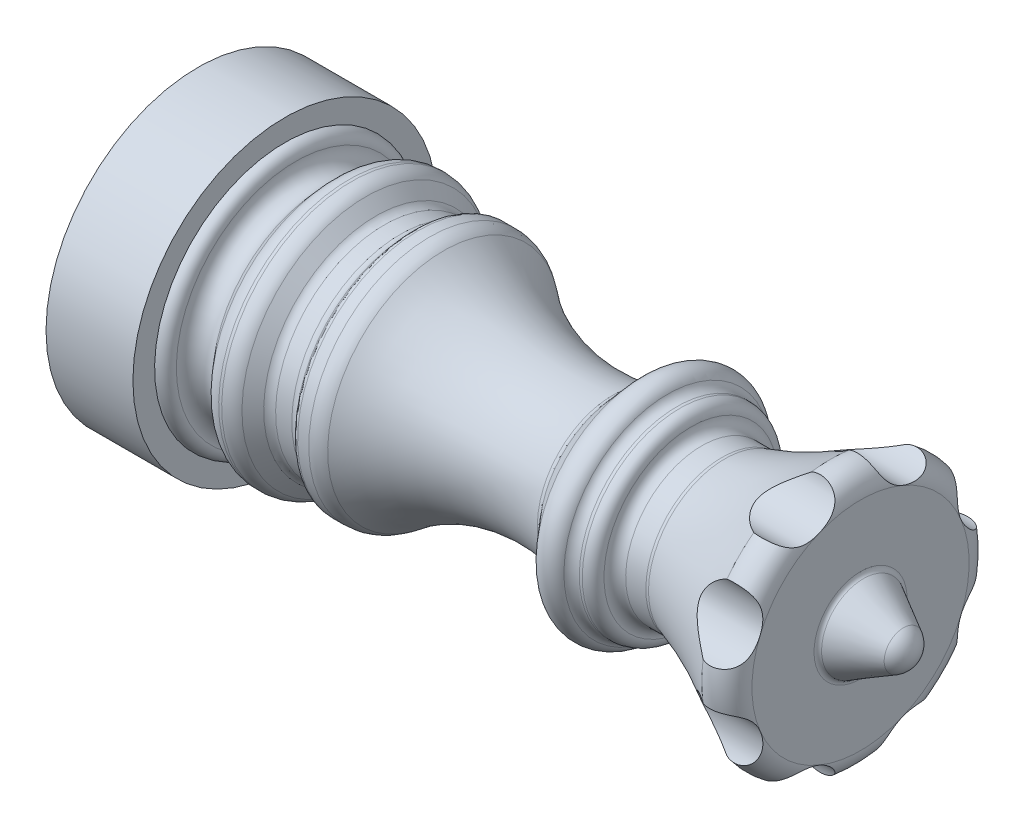
from build123d import *

# Parameters (mm, degrees)
FILETE2_R                 = 0.5
FILETE3_R                 = 0.5
ESBO_O2_R                 = 1.75
CORTE_EXTRUS_O1_DEPTH     = 5
PADR_OCIRCULAR1_COUNT     = 8
FILETE4_R                 = 0.25
FILETE5_R                 = 1
CORPO_MOVER_COPIAR1_ANGLE = 22.5
CHANFRO1_SIZE             = 0.35
SKETCH1_R                 = 7
BOSS_EXTRUDE1_DEPTH       = 1
BOSS_EXTRUDE2_START       = 3
SKETCH1_2_R               = 7
BOSS_EXTRUDE2_DEPTH       = 3
SKETCH2_R                 = 6.05
CUT_EXTRUDE1_DEPTH        = 3.2


with BuildPart() as part:
    # Esboço1 → Revolução1 (revolve)
    with BuildSketch(Plane.XY, mode=Mode.PRIVATE) as revolu_o1_sk:
        with BuildLine():
            Line((0, 6), (0, 0))
            Line((0, 0), (30, 0))
            ThreePointArc((30, 0), (29.859693117, 0.516050041), (29.477403873, 0.890013408))
            Line((29.477403873, 0.890013408), (27.5, 1.99328989))
            Line((27.5, 1.99328989), (27.5, 5))
            ThreePointArc((27.5, 5), (27.049451102, 5.835525874), (26.103793027, 5.918161225))
            ThreePointArc((26.103793027, 5.918161225), (23.749832258, 4.497667656), (21.187881336, 3.5))
            Line((21.187881336, 3.5), (19.687881336, 3.5))
            Line((19.687881336, 3.5), (19.687881336, 4.5))
            Line((19.687881336, 4.5), (18.687881336, 4.5))
            ThreePointArc((18.687881336, 4.5), (18.207548082, 5.106223569), (17.462095944, 4.9))
            Line((17.462095944, 4.9), (16.245094511, 3.5))
            ThreePointArc((16.245094511, 3.5), (11.885183427, 3.516397611), (8.040424988, 5.572346561))
            Line((8.040424988, 5.572346561), (7.040424988, 5.572346561))
            Line((7.040424988, 5.572346561), (6.542891713, 5))
            Line((6.542891713, 5), (5.342891713, 5))
            Line((5.342891713, 5), (4.727740801, 5.707650175))
            ThreePointArc((4.727740801, 5.707650175), (4.438726914, 5.92346708), (4.086237658, 6))
            Line((4.086237658, 6), (3.949519781, 6))
            ThreePointArc((3.949519781, 6), (3.597030525, 5.92346708), (3.308016638, 5.707650175))
            Line((3.308016638, 5.707650175), (2.728296706, 5.04075868))
            ThreePointArc((2.728296706, 5.04075868), (1.954854833, 4.844329468), (1.5, 5.5))
            ThreePointArc((1.5, 5.5), (1.353553391, 5.853553391), (1, 6))
            Line((1, 6), (0, 6))
        make_face()
    revolve(revolu_o1_sk.sketch.rotate(Axis((0, 0, 0), (1, 0, 0)), 90), axis=Axis((0, 0, 0), (1, 0, 0)))

    # Filete2
    filete2_edges = [part.edges().sort_by_distance(p)[0] for p in [
        (19.687881336, 0, -4.5),
    ]]
    fillet(filete2_edges, radius=FILETE2_R)

    # Filete3
    filete3_edges = [part.edges().sort_by_distance(p)[0] for p in [
        (5.342891713, 0, -5),
        (6.542891713, 0, -5),
        (16.245094511, 0, -3.5),
        (18.687881336, 0, -4.5),
        (19.687881336, 0, -3.5),
        (21.187881336, 0, -3.5),
    ]]
    fillet(filete3_edges, radius=FILETE3_R - 0.0001)  # a hair under: the kernel refuses the full size

    # Esboço2 → Corte-extrusão1 (cut)
    with BuildSketch(Plane(origin=(27.5, 0, 0), x_dir=(0, 0, -1), z_dir=(1, 0, 0))):
        with Locations((-6.75, 0)):
            Circle(ESBO_O2_R)
    corte_extrus_o1 = extrude(amount=-CORTE_EXTRUS_O1_DEPTH, mode=Mode.SUBTRACT)

    # PadrãoCircular1: Corte-extrusão1 ×8 about axis
    padr_ocircular1_axis = Axis((0, 0, 0), (1, 0, 0))
    for i in range(1, PADR_OCIRCULAR1_COUNT):
        add(corte_extrus_o1.rotate(padr_ocircular1_axis, i * 360 / PADR_OCIRCULAR1_COUNT), mode=Mode.SUBTRACT)

    # Filete4
    filete4_edges = [part.edges().sort_by_distance(p)[0] for p in [
        (27.5, 0, -1.99328989),
        (7.040424988, 0, -5.572346561),
    ]]
    fillet(filete4_edges, radius=FILETE4_R)

    # Filete5
    filete5_edges = [part.edges().sort_by_distance(p)[0] for p in [
        (8.040424988, 0, -5.572346561),
    ]]
    fillet(filete5_edges, radius=FILETE5_R)


with BuildPart() as part_1:
    # Corpo-Mover/Copiar1: moved
    add(part.part.rotate(Axis((0, 0, 0), (-1, 0, 0)), CORPO_MOVER_COPIAR1_ANGLE))

    # Chanfro1
    chanfro1_edges = [part_1.edges().sort_by_distance(p)[0] for p in [
        (0, -2.296100594, -5.543277195),
    ]]
    chamfer(chanfro1_edges, length=CHANFRO1_SIZE)

    # Sketch1 → Boss-Extrude1 (add)
    with BuildSketch(Plane.ZY):
        Circle(SKETCH1_R)
    extrude(amount=-BOSS_EXTRUDE1_DEPTH)

    # Sketch1<2> → Boss-Extrude2 (add)
    with BuildSketch(Plane.ZY.offset(BOSS_EXTRUDE2_START)):
        Circle(SKETCH1_2_R)
    extrude(amount=-BOSS_EXTRUDE2_DEPTH)

    # Sketch2 → Cut-Extrude1 (cut)
    with BuildSketch(Plane.ZY.offset(3)):
        Circle(SKETCH2_R)
    extrude(amount=-CUT_EXTRUDE1_DEPTH, mode=Mode.SUBTRACT)


solid = part_1.part
